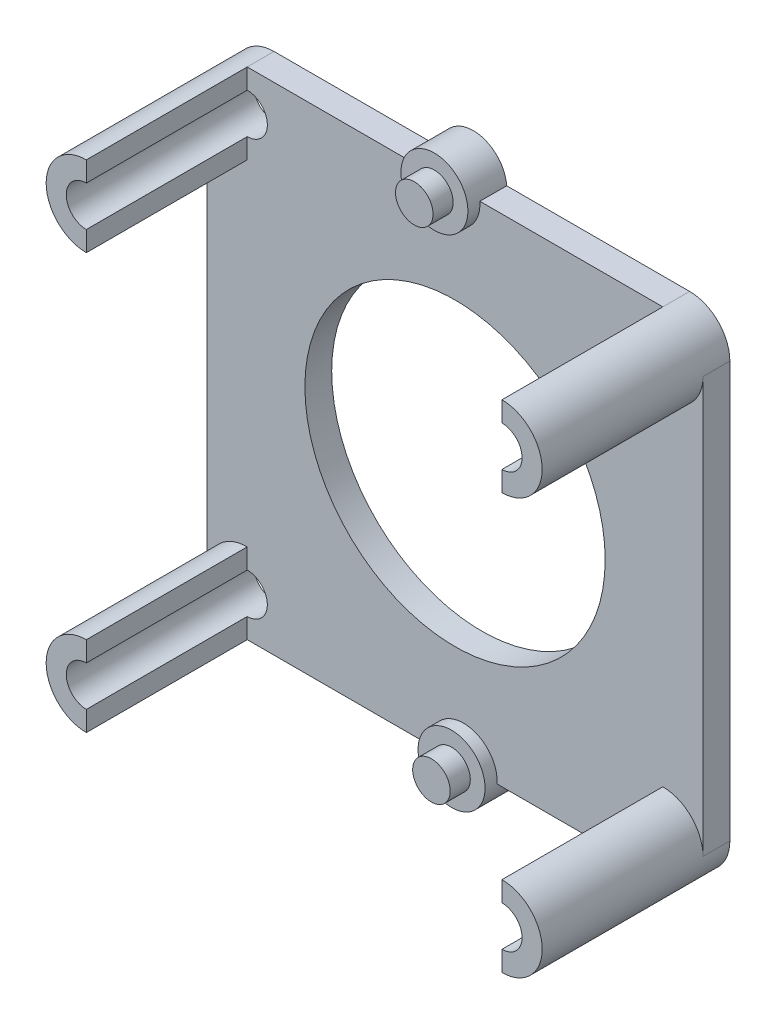
from build123d import *
from build123d.topology import SkipClean

# Parameters (mm, degrees)
SKETCH1_R      = 1.5
SKETCH1_R_2    = 11.2
EXTRUDE1_DEPTH = 2
SKETCH2_R      = 2.5
EXTRUDE2_DEPTH = 0.9
SKETCH3_R      = 1.4
EXTRUDE3_DEPTH = 1.5
EXTRUDE4_DEPTH = 12


with BuildPart() as part:
    # Sketch1 → Extrude1 (new body)
    with BuildSketch(Plane.XY):
        with BuildLine():
            Line((-18.5, 15.5), (-18.5, -15.5))
            ThreePointArc((-18.5, -15.5), (-17.621320344, -17.621320344), (-15.5, -18.5))
            Line((-15.5, -18.5), (-1.853762559, -18.5))
            ThreePointArc((-1.853762559, -18.5), (0.639748006, -20.81998593), (3.13325857, -18.5))
            Line((3.13325857, -18.5), (15.5, -18.5))
            ThreePointArc((15.5, -18.5), (17.621320344, -17.621320344), (18.5, -15.5))
            Line((18.5, -15.5), (18.5, 15.5))
            ThreePointArc((18.5, 15.5), (17.621320344, 17.621320344), (15.5, 18.5))
            Line((15.5, 18.5), (1.853762559, 18.5))
            ThreePointArc((1.853762559, 18.5), (-0.639748006, 20.81998593), (-3.13325857, 18.5))
            Line((-3.13325857, 18.5), (-15.5, 18.5))
            ThreePointArc((-15.5, 18.5), (-17.621320344, 17.621320344), (-18.5, 15.5))
        make_face()
        with Locations((15.5, 15.5)):
            Circle(SKETCH1_R, mode=Mode.SUBTRACT)
        with Locations((-15.5, 15.5)):
            Circle(SKETCH1_R, mode=Mode.SUBTRACT)
        Circle(SKETCH1_R_2, mode=Mode.SUBTRACT)
        with Locations((15.5, -15.5)):
            Circle(SKETCH1_R, mode=Mode.SUBTRACT)
        with Locations((-15.5, -15.5)):
            Circle(SKETCH1_R, mode=Mode.SUBTRACT)
    extrude(amount=EXTRUDE1_DEPTH)

    # Sketch2 → Extrude2 (add)
    with BuildSketch(Plane.XY.offset(2)):
        with Locations((-0.639748006, 18.31998593)):
            Circle(SKETCH2_R)
        with Locations((0.639748006, -18.31998593)):
            Circle(SKETCH2_R)
    extrude(amount=EXTRUDE2_DEPTH)

    # Sketch3 → Extrude3 (add)
    with BuildSketch(Plane.XY.offset(2.9)):
        with Locations((-0.639748006, 18.31998593)):
            Circle(SKETCH3_R)
        with Locations((0.639748006, -18.31998593)):
            Circle(SKETCH3_R)
    extrude(amount=EXTRUDE3_DEPTH)

    # Sketch4 → Extrude4 (add)
    with SkipClean():  # the faces are left unmerged after this step: merging them gives an invalid solid
        with BuildSketch(Plane.XY.offset(2)):
            with BuildLine():
                Line((15.5, -14), (15.5, -12.5))
                ThreePointArc((15.5, -12.5), (18.5, -15.5), (15.5, -18.5))
                Line((15.5, -18.5), (15.5, -17))
                ThreePointArc((15.5, -17), (17, -15.5), (15.5, -14))
            make_face()
            with BuildLine():
                Line((-15.5, -14), (-15.5, -12.5))
                ThreePointArc((-15.5, -12.5), (-18.5, -15.5), (-15.5, -18.5))
                Line((-15.5, -18.5), (-15.5, -17))
                ThreePointArc((-15.5, -17), (-17, -15.5), (-15.5, -14))
            make_face()
            with BuildLine():
                Line((-15.5, 17), (-15.5, 18.5))
                ThreePointArc((-15.5, 18.5), (-18.5, 15.5), (-15.5, 12.5))
                Line((-15.5, 12.5), (-15.5, 14))
                ThreePointArc((-15.5, 14), (-17, 15.5), (-15.5, 17))
            make_face()
            with BuildLine():
                Line((15.5, 17), (15.5, 18.5))
                ThreePointArc((15.5, 18.5), (18.5, 15.5), (15.5, 12.5))
                Line((15.5, 12.5), (15.5, 14))
                ThreePointArc((15.5, 14), (17, 15.5), (15.5, 17))
            make_face()
        extrude(amount=EXTRUDE4_DEPTH)


solid = part.part
